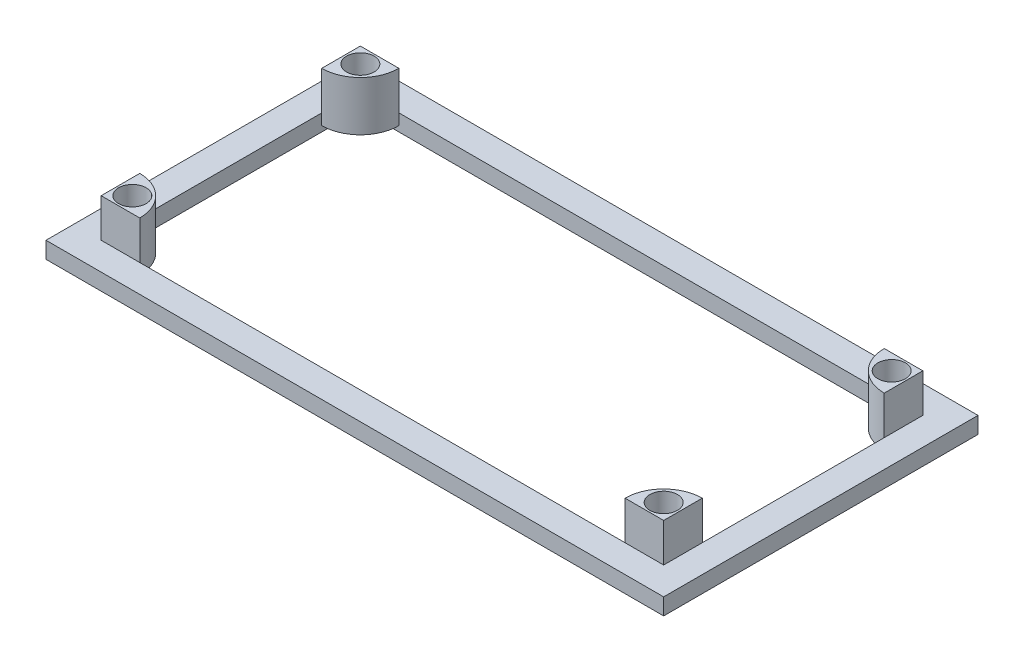
from build123d import *

# Parameters (mm, degrees)
SKETCH1_W                                  = 112
SKETCH1_H                                  = 57
SKETCH1_W_2                                = 102
SKETCH1_H_2                                = 47
BOSS_EXTRUDE1_DEPTH                        = 3
BOSS_EXTRUDE2_START                        = -2
SKETCH2_R                                  = 2.5
BOSS_EXTRUDE2_DEPTH                        = 9
MIRROR1_START                              = -2
MIRROR1_AT_THE_SECOND_PLANE_COPY_1_SKETC_R = 2.5
MIRROR1_AT_THE_SECOND_PLANE_COPY_1_DEPTH   = 9


with BuildPart() as part:
    # Sketch1 → Boss-Extrude1 (new body)
    with BuildSketch(Plane(origin=(0, 0, 0), x_dir=(1, 0, 0), z_dir=(0, 1, 0))):
        Rectangle(SKETCH1_W, SKETCH1_H)
        Rectangle(SKETCH1_W_2, SKETCH1_H_2, mode=Mode.SUBTRACT)
    extrude(amount=BOSS_EXTRUDE1_DEPTH)

    # Sketch2 → Boss-Extrude2 (add)
    with BuildSketch(Plane(origin=(0, 3, 0), x_dir=(1, 0, 0), z_dir=(0, 1, 0)).offset(BOSS_EXTRUDE2_START)):
        with BuildLine():
            Line((-51, -23.5), (-44, -23.5))
            ThreePointArc((-44, -23.5), (-46.050252532, -18.550252532), (-51, -16.5))
            Line((-51, -16.5), (-51, -23.5))
        make_face()
        with Locations((-48.171572875, -20.671572875)):
            Circle(SKETCH2_R, mode=Mode.SUBTRACT)
    boss_extrude2 = extrude(amount=BOSS_EXTRUDE2_DEPTH)

    # Mirror1: Boss-Extrude2 across plane
    add(boss_extrude2.mirror(Plane.XY))

    # Mirror1 at the second plane: Boss-Extrude2 across plane
    add(boss_extrude2.mirror(Plane(origin=(0, 0, 0), x_dir=(0, 0, 1), z_dir=(1, 0, 0))))

    # Mirror1 at the second plane copy 1 sketc → Mirror1 at the second plane copy 1 (add)
    with BuildSketch(Plane(origin=(0, 3, 0), x_dir=(-1, 0, 0), z_dir=(0, 1, 0)).offset(MIRROR1_START)):
        with BuildLine():
            Line((-51, -23.5), (-44, -23.5))
            ThreePointArc((-44, -23.5), (-46.050252532, -18.550252532), (-51, -16.5))
            Line((-51, -16.5), (-51, -23.5))
        make_face()
        with Locations((-48.171572875, -20.671572875)):
            Circle(MIRROR1_AT_THE_SECOND_PLANE_COPY_1_SKETC_R, mode=Mode.SUBTRACT)
    extrude(amount=MIRROR1_AT_THE_SECOND_PLANE_COPY_1_DEPTH)


solid = part.part
